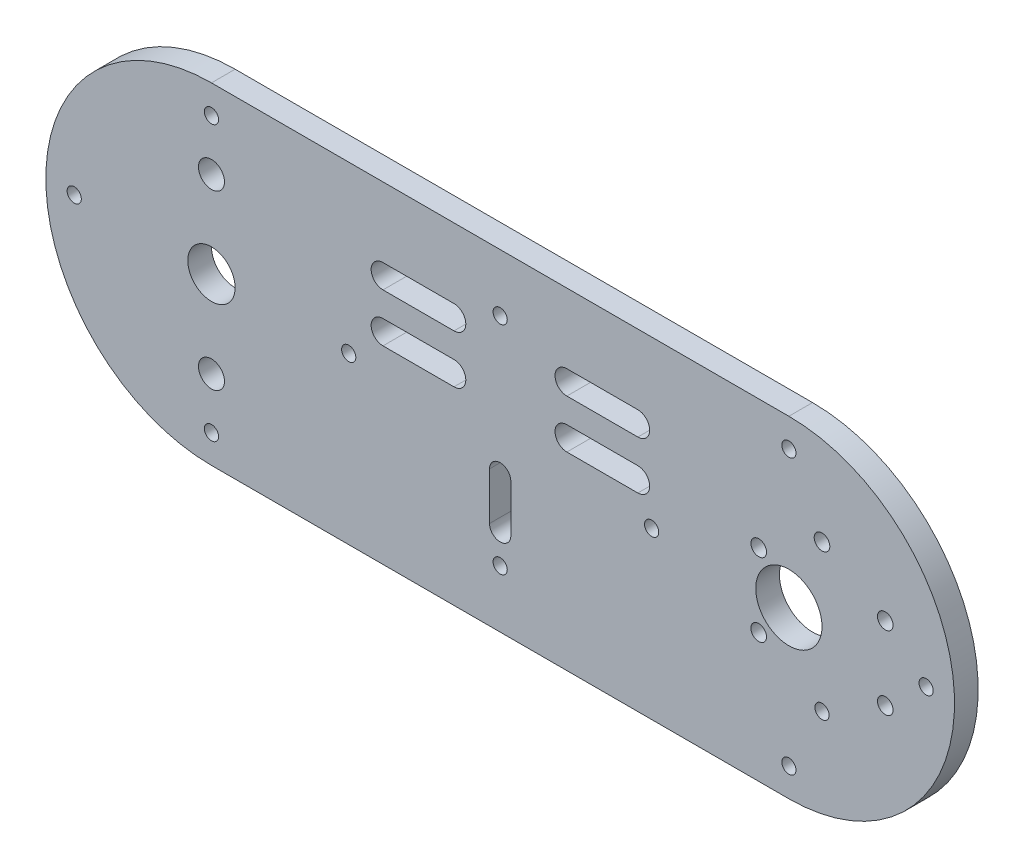
from build123d import *

# Parameters (mm, degrees)
SKETCH1_R           = 7
SKETCH1_R_2         = 5
SKETCH1_R_3         = 1.5
SKETCH1_R_4         = 2.75
SKETCH1_R_5         = 1.65
BOSS_EXTRUDE1_DEPTH = 5


with BuildPart() as part:
    # Sketch1 → Boss-Extrude1 (new body)
    with BuildSketch(Plane.XY):
        with BuildLine():
            Line((61, -35), (-61, -35))
            ThreePointArc((-61, -35), (-96, 0), (-61, 35))
            Line((-61, 35), (61, 35))
            ThreePointArc((61, 35), (96, 0), (61, -35))
        make_face()
        with Locations((61, 0)):
            Circle(SKETCH1_R, mode=Mode.SUBTRACT)
        with Locations((-61, 0)):
            Circle(SKETCH1_R_2, mode=Mode.SUBTRACT)
        with Locations((-61, -29)):
            Circle(SKETCH1_R_3, mode=Mode.SUBTRACT)
        with Locations((-61, 29)):
            Circle(SKETCH1_R_3, mode=Mode.SUBTRACT)
        with Locations((61, 29)):
            Circle(SKETCH1_R_3, mode=Mode.SUBTRACT)
        with Locations((61, -29)):
            Circle(SKETCH1_R_3, mode=Mode.SUBTRACT)
        with Locations((0, -22.872790913)):
            Circle(SKETCH1_R_3, mode=Mode.SUBTRACT)
        with Locations((0, 22.872790913)):
            Circle(SKETCH1_R_3, mode=Mode.SUBTRACT)
        with Locations((-61, 18.25)):
            Circle(SKETCH1_R_4, mode=Mode.SUBTRACT)
        with Locations((-61, -18.25)):
            Circle(SKETCH1_R_4, mode=Mode.SUBTRACT)
        with Locations((-90, 0)):
            Circle(SKETCH1_R_3, mode=Mode.SUBTRACT)
        with Locations((-32, 0)):
            Circle(SKETCH1_R_3, mode=Mode.SUBTRACT)
        with Locations((90, 0)):
            Circle(SKETCH1_R_3, mode=Mode.SUBTRACT)
        with Locations((32, 0)):
            Circle(SKETCH1_R_3, mode=Mode.SUBTRACT)
        with Locations((68, -15.5)):
            Circle(SKETCH1_R_3, mode=Mode.SUBTRACT)
        with Locations((68, 15.5)):
            Circle(SKETCH1_R_5, mode=Mode.SUBTRACT)
        with Locations((54.630491741, 7.75587519)):
            Circle(SKETCH1_R_5, mode=Mode.SUBTRACT)
        with Locations((54.630491741, -7.75587519)):
            Circle(SKETCH1_R_5, mode=Mode.SUBTRACT)
        with Locations((81.369508259, -7.75587519)):
            Circle(SKETCH1_R_5, mode=Mode.SUBTRACT)
        with Locations((81.369508259, 7.75587519)):
            Circle(SKETCH1_R_5, mode=Mode.SUBTRACT)
        with BuildLine():
            Line((2.25, -6.25), (2.25, -16.25))
            ThreePointArc((2.25, -16.25), (0, -18.5), (-2.25, -16.25))
            Line((-2.25, -16.25), (-2.25, -6.25))
            ThreePointArc((-2.25, -6.25), (0, -4), (2.25, -6.25))
        make_face(mode=Mode.SUBTRACT)
        with BuildLine():
            Line((-24.76, 10), (-9.76, 10))
            ThreePointArc((-9.76, 10), (-7.26, 7.5), (-9.76, 5))
            Line((-9.76, 5), (-24.76, 5))
            ThreePointArc((-24.76, 5), (-27.26, 7.5), (-24.76, 10))
        make_face(mode=Mode.SUBTRACT)
        with BuildLine():
            Line((-24.76, 20.24), (-9.76, 20.24))
            ThreePointArc((-9.76, 20.24), (-7.26, 17.74), (-9.76, 15.24))
            Line((-9.76, 15.24), (-24.76, 15.24))
            ThreePointArc((-24.76, 15.24), (-27.26, 17.74), (-24.76, 20.24))
        make_face(mode=Mode.SUBTRACT)
        with BuildLine():
            Line((14.09, 10), (29.09, 10))
            ThreePointArc((29.09, 10), (31.59, 7.5), (29.09, 5))
            Line((29.09, 5), (14.09, 5))
            ThreePointArc((14.09, 5), (11.59, 7.5), (14.09, 10))
        make_face(mode=Mode.SUBTRACT)
        with BuildLine():
            Line((14.09, 20.24), (29.09, 20.24))
            ThreePointArc((29.09, 20.24), (31.59, 17.74), (29.09, 15.24))
            Line((29.09, 15.24), (14.09, 15.24))
            ThreePointArc((14.09, 15.24), (11.59, 17.74), (14.09, 20.24))
        make_face(mode=Mode.SUBTRACT)
    extrude(amount=BOSS_EXTRUDE1_DEPTH)


solid = part.part
